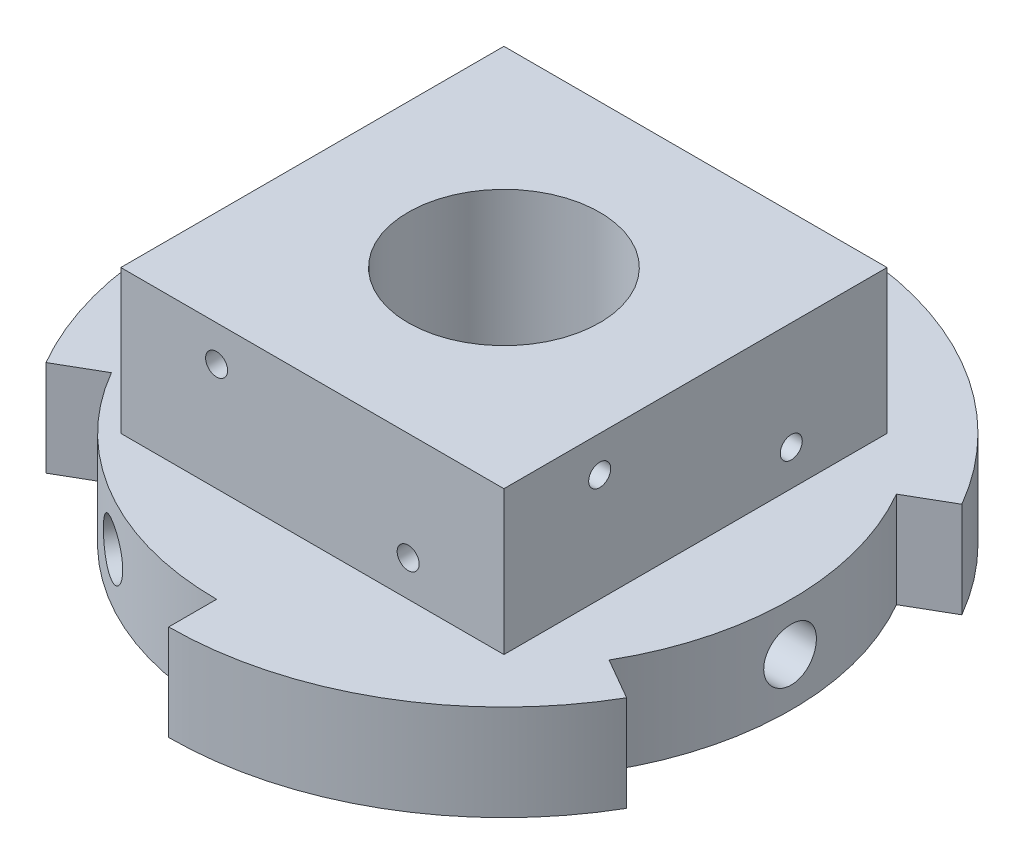
from build123d import *

# Parameters (mm, degrees)
BOSS_EXTRUDE3_DEPTH = 10
SKETCH2_R           = 2.75
CUT_EXTRUDE1_DEPTH  = 25
CIRPATTERN1_COUNT   = 3
SKETCH3_W           = 40
SKETCH3_H           = 40
BOSS_EXTRUDE4_DEPTH = 15
SKETCH5_R           = 10
CUT_EXTRUDE5_DEPTH  = 56.452682577
SKETCH4_R           = 1.15
CUT_EXTRUDE6_DEPTH  = 6
CIRPATTERN2_COUNT   = 4


with BuildPart() as part:
    # Sketch1 → Boss-Extrude3 (new body)
    with BuildSketch(Plane(origin=(0, 0, 0), x_dir=(1, 0, 0), z_dir=(0, 1, 0))):
        with BuildLine():
            Line((-25.980762114, 15), (-30.310889132, 17.5))
            ThreePointArc((-30.310889132, 17.5), (-35, 0), (-30.310889132, -17.5))
            Line((-30.310889132, -17.5), (-25.980762114, -15))
            ThreePointArc((-25.980762114, -15), (-15, -25.980762114), (0, -30))
            Line((0, -30), (0, -35))
            ThreePointArc((0, -35), (17.5, -30.310889132), (30.310889132, -17.5))
            Line((30.310889132, -17.5), (25.980762114, -15))
            ThreePointArc((25.980762114, -15), (30, 0), (25.980762114, 15))
            Line((25.980762114, 15), (30.310889132, 17.5))
            ThreePointArc((30.310889132, 17.5), (17.5, 30.310889132), (0, 35))
            Line((0, 35), (0, 30))
            ThreePointArc((0, 30), (-15, 25.980762114), (-25.980762114, 15))
        make_face()
    extrude(amount=BOSS_EXTRUDE3_DEPTH)

    # Sketch2 → Cut-Extrude1 (cut)
    with BuildSketch(Plane(origin=(40, 0, 0), x_dir=(0, 0, -1), z_dir=(1, 0, 0))):
        with Locations((0, 5)):
            Circle(SKETCH2_R)
    cut_extrude1 = extrude(amount=-CUT_EXTRUDE1_DEPTH, mode=Mode.SUBTRACT)

    # CirPattern1: Cut-Extrude1 ×3 about axis
    cirpattern1_axis = Axis((0, 10, 0), (0, -1, 0))
    for i in range(1, CIRPATTERN1_COUNT):
        add(cut_extrude1.rotate(cirpattern1_axis, i * 360 / CIRPATTERN1_COUNT), mode=Mode.SUBTRACT)

    # Sketch3 → Boss-Extrude4 (add)
    with BuildSketch(Plane(origin=(0, 10, 0), x_dir=(1, 0, 0), z_dir=(0, 1, 0))):
        Rectangle(SKETCH3_W, SKETCH3_H)
    extrude(amount=BOSS_EXTRUDE4_DEPTH)

    # Sketch5 → Cut-Extrude5 (cut, through all)
    with BuildSketch(Plane(origin=(0, 25, 0), x_dir=(1, 0, 0), z_dir=(0, 1, 0))):
        Circle(SKETCH5_R)
    extrude(amount=-CUT_EXTRUDE5_DEPTH, mode=Mode.SUBTRACT)

    # Sketch4 → Cut-Extrude6 (cut)
    with BuildSketch(Plane(origin=(20, 0, 0), x_dir=(0, 0, -1), z_dir=(1, 0, 0))):
        with Locations((-10, 21.25)):
            Circle(SKETCH4_R)
        with Locations((10, 13.75)):
            Circle(SKETCH4_R)
    cut_extrude6 = extrude(amount=-CUT_EXTRUDE6_DEPTH, mode=Mode.SUBTRACT)

    # CirPattern2: Cut-Extrude6 ×4 about axis
    cirpattern2_axis = Axis((0, 0, 0), (0, 1, 0))
    for i in range(1, CIRPATTERN2_COUNT):
        add(cut_extrude6.rotate(cirpattern2_axis, i * 360 / CIRPATTERN2_COUNT), mode=Mode.SUBTRACT)


solid = part.part
